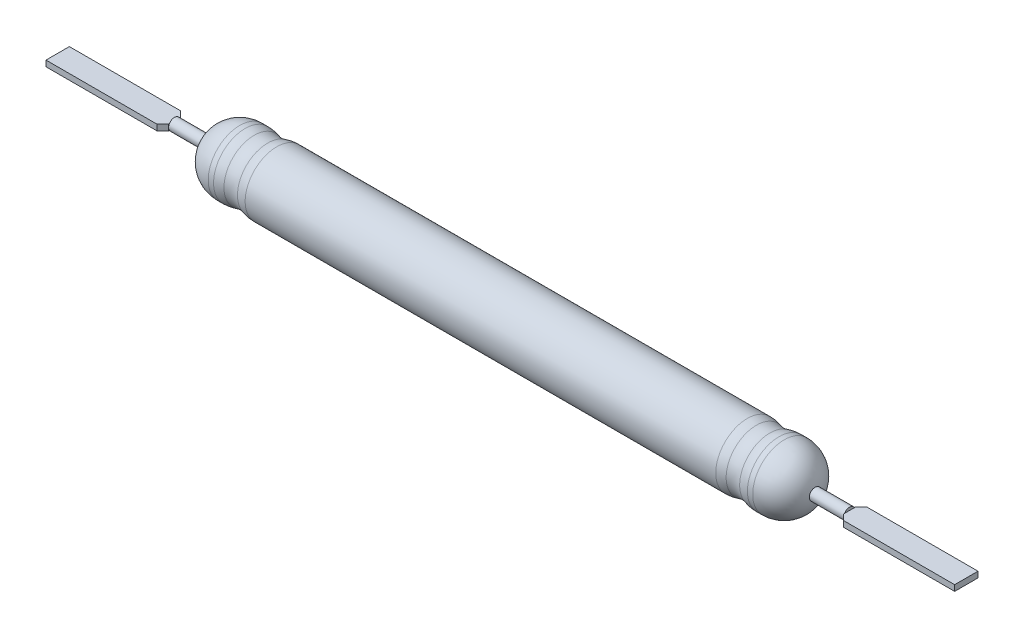
from build123d import *

# Parameters (mm, degrees)
SKETCH_7_R      = 0.5
EXTRUDE_1_DEPTH = 57.8
SKETCH_8_W      = 2
SKETCH_8_H      = 0.5
EXTRUDE_2_DEPTH = 10
CHAMFER_1_SIZE  = 0.5
SKETCH_9_W      = 2
SKETCH_9_H      = 0.5
EXTRUDE_3_DEPTH = 10
CHAMFER_2_SIZE  = 0.5


with BuildPart() as part:
    # По траектории1: sweep along a path in Эскиз4
    with BuildLine(Plane(origin=(0, 0, 0), x_dir=(0, 0, -1), z_dir=(1, 0, 0))) as sweep_1_path:
        CenterArc((0, 0), 2.7, 0, 360)
    # Эскиз3 → По траектории1 (sweep)
    with BuildSketch(Plane(origin=(0, 0, 0), x_dir=(1, 0, 0), z_dir=(0, 1, 0))):
        with BuildLine():
            Line((48.854990775, 2.7), (49.31, 2.7))
            ThreePointArc((49.31, 2.7), (51.212117241, 1.912117241), (52, 0.01))
            Line((52, 0.01), (52, 0))
            Line((52, 0), (0, 0))
            Line((0, 0), (0, 0.01))
            ThreePointArc((0, 0.01), (0.787882759, 1.912117241), (2.69, 2.7))
            Line((2.69, 2.7), (3.145009225, 2.7))
            ThreePointArc((3.145009225, 2.7), (3.537804142, 2.671167442), (3.922178774, 2.585287846))
            ThreePointArc((3.922178774, 2.585287846), (4.5, 2.5), (5.077821226, 2.585287846))
            ThreePointArc((5.077821226, 2.585287846), (5.462195858, 2.671167442), (5.854990775, 2.7))
            Line((5.854990775, 2.7), (46.145009225, 2.7))
            ThreePointArc((46.145009225, 2.7), (46.537804142, 2.671167442), (46.922178774, 2.585287846))
            ThreePointArc((46.922178774, 2.585287846), (47.5, 2.5), (48.077821226, 2.585287846))
            ThreePointArc((48.077821226, 2.585287846), (48.462195858, 2.671167442), (48.854990775, 2.7))
        make_face()
    sweep(path=sweep_1_path.line)

    # Эскиз7 → Бобышка-Вытянуть1 (add)
    with BuildSketch(Plane(origin=(-2.9, 0, 0), x_dir=(0, 0, -1), z_dir=(1, 0, 0))):
        Circle(SKETCH_7_R)
    extrude(amount=EXTRUDE_1_DEPTH)

    # Эскиз8 → Бобышка-Вытянуть2 (add)
    with BuildSketch(Plane.ZY.offset(2.9)):
        Rectangle(SKETCH_8_W, SKETCH_8_H)
    extrude(amount=EXTRUDE_2_DEPTH)

    # Фаска1
    chamfer_1_edges = [part.edges().sort_by_distance(p)[0] for p in [
        (-2.9, 0, -1),
        (-2.9, 0, 1),
    ]]
    chamfer(chamfer_1_edges, length=CHAMFER_1_SIZE - 0.0001)  # a hair under: the kernel refuses the full size

    # Эскиз9 → Бобышка-Вытянуть3 (add)
    with BuildSketch(Plane(origin=(54.9, 0, 0), x_dir=(0, 0, -1), z_dir=(1, 0, 0))):
        Rectangle(SKETCH_9_W, SKETCH_9_H)
    extrude(amount=EXTRUDE_3_DEPTH)

    # Фаска2
    chamfer_2_edges = [part.edges().sort_by_distance(p)[0] for p in [
        (54.9, 0, -1),
        (54.9, 0, 1),
    ]]
    chamfer(chamfer_2_edges, length=CHAMFER_2_SIZE - 0.0001)  # a hair under: the kernel refuses the full size


solid = part.part
